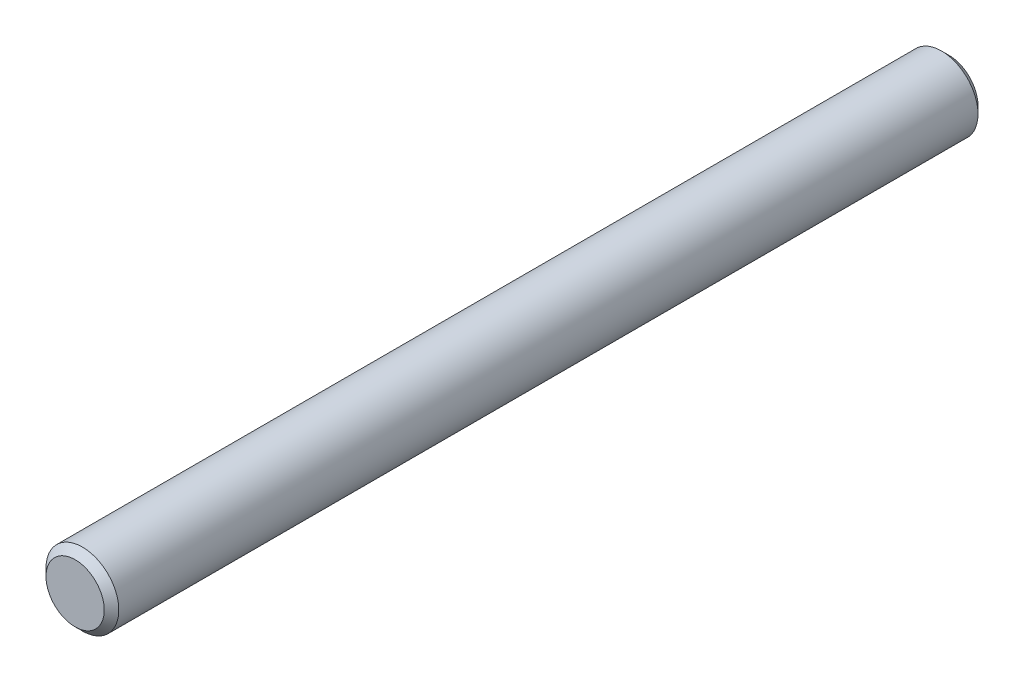
from build123d import *

# Parameters (mm, degrees)
SKETCH1_R      = 3.175
EXTRUDE1_DEPTH = 38.1
CHAMFER1_SIZE  = 0.635


with BuildPart() as part:
    # Sketch1 → Extrude1 (new, symmetric)
    with BuildSketch(Plane.XY):
        Circle(SKETCH1_R)
    extrude(amount=EXTRUDE1_DEPTH, both=True)

    # Chamfer1
    chamfer1_edges = [part.edges().sort_by_distance(p)[0] for p in [
        (-3.175, 0, -38.1),
        (-3.175, 0, 38.1),
    ]]
    chamfer(chamfer1_edges, length=CHAMFER1_SIZE)


solid = part.part
